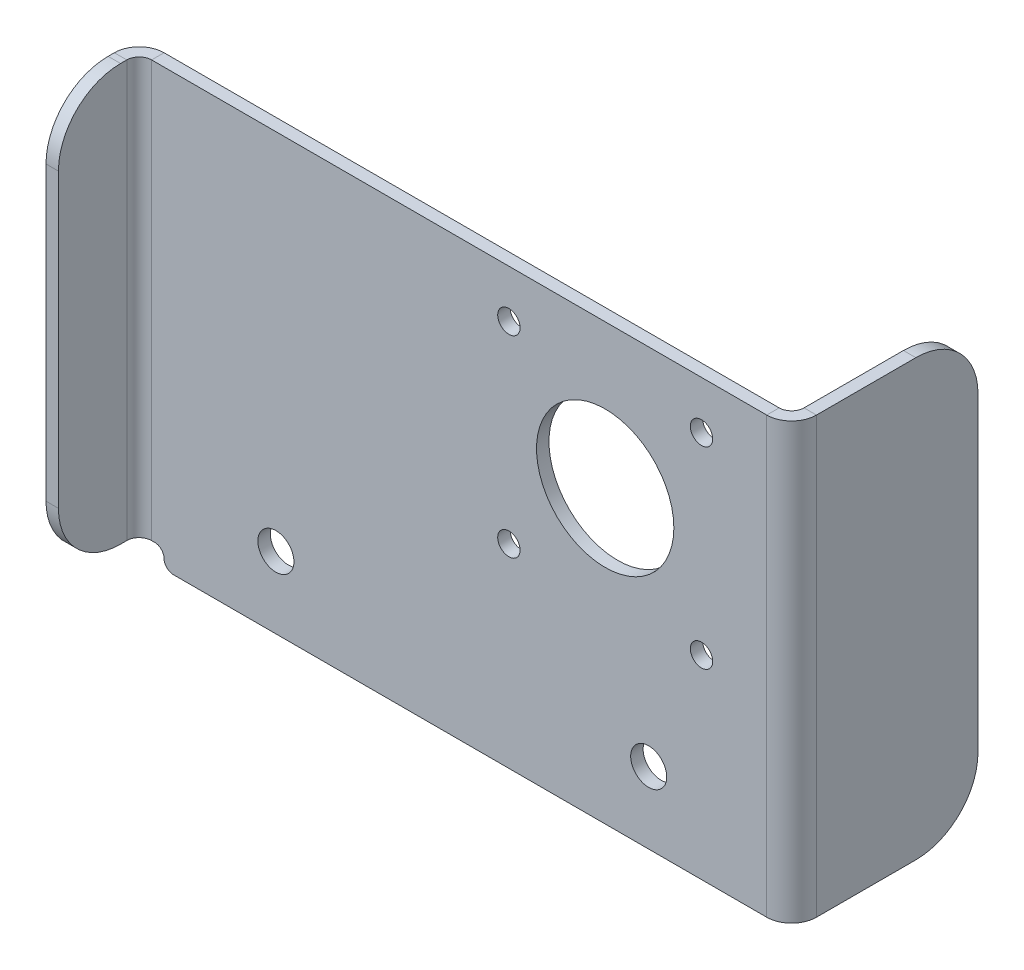
from build123d import *

# Parameters (mm, degrees)
SKETCH1_W            = 96
SKETCH1_H            = 70
BASE_FLANGE1_DEPTH   = 2
SKETCH6_R            = 11.05
CUT_EXTRUDE1_DEPTH   = 2
M3_CLEARANCE_HOLE1_D = 3.6
EDGE_FLANGE1_DEPTH   = 67
M5_CLEARANCE_HOLE1_D = 5.8
EDGE_FLANGE2_DEPTH   = 70
FILLET1_R            = 10
FILLET2_R            = 1.5


# Sheet-metal steps are written as plain solids
with BuildPart() as part:
    # Sketch1 → Base-Flange1 (new body)
    with BuildSketch(Plane.XY):
        Rectangle(SKETCH1_W, SKETCH1_H)
    extrude(amount=-BASE_FLANGE1_DEPTH)

    # Sketch6 → Cut-Extrude1 (cut)
    with BuildSketch(Plane.XY):
        with Locations((23, 11.8)):
            Circle(SKETCH6_R)
    extrude(amount=-CUT_EXTRUDE1_DEPTH, mode=Mode.SUBTRACT)

    # M3 Clearance Hole1 (through all)
    with Locations(Plane.XY):
        with Locations((38.5, 27.3), (38.5, -3.7), (7.5, 27.3), (7.5, -3.7)):
            Hole(M3_CLEARANCE_HOLE1_D / 2)

    # Edge-Flange1 section (across the edge) → Edge-Flange1 (add)
    with BuildSketch(Plane(origin=(-52, 35, 0), x_dir=(1, 0, 0), z_dir=(0, -1, 0))):
        with BuildLine():
            Line((-2, 2), (-2, 13))
            Line((-2, 13), (0, 13))
            Line((0, 13), (0, 2))
            ThreePointArc((0, 2), (0.585786438, 0.585786438), (2, 0))
            Line((2, 0), (4, 0))
            Line((4, 0), (4, -2))
            Line((4, -2), (2, -2))
            ThreePointArc((2, -2), (-0.828427125, -0.828427125), (-2, 2))
        make_face()
    extrude(amount=EDGE_FLANGE1_DEPTH)

    # M5 Clearance Hole1 (through all)
    with Locations(Plane.XY):
        with Locations((30, -23.5), (-30, -23.5)):
            Hole(M5_CLEARANCE_HOLE1_D / 2)

    # Edge-Flange2 section (across the edge) → Edge-Flange2 (add)
    with BuildSketch(Plane(origin=(51, 35, -2), x_dir=(-1, 0, 0), z_dir=(0, -1, 0))):
        with BuildLine():
            Line((-2, 2), (-2, 28))
            Line((-2, 28), (0, 28))
            Line((0, 28), (0, 2))
            ThreePointArc((0, 2), (0.585786438, 0.585786438), (2, 0))
            Line((2, 0), (3, 0))
            Line((3, 0), (3, -2))
            Line((3, -2), (2, -2))
            ThreePointArc((2, -2), (-0.828427125, -0.828427125), (-2, 2))
        make_face()
    extrude(amount=EDGE_FLANGE2_DEPTH)

    # Fillet1
    fillet1_edges = [part.edges().sort_by_distance(p)[0] for p in [
        (52, 35, -30),
        (52, -35, -30),
        (-53, 35, 13),
        (-53, -32, 13),
    ]]
    fillet(fillet1_edges, radius=FILLET1_R)

    # Fillet2
    fillet2_edges = [part.edges().sort_by_distance(p)[0] for p in [
        (-48, -32, -1),
    ]]
    fillet(fillet2_edges, radius=FILLET2_R)
    fillet2_2_edges = [part.edges().sort_by_distance(p)[0] for p in [
        (-48, -35, -1),
    ]]
    fillet(fillet2_2_edges, radius=FILLET2_R - 0.0001)  # a hair under: the kernel refuses the full size


solid = part.part
